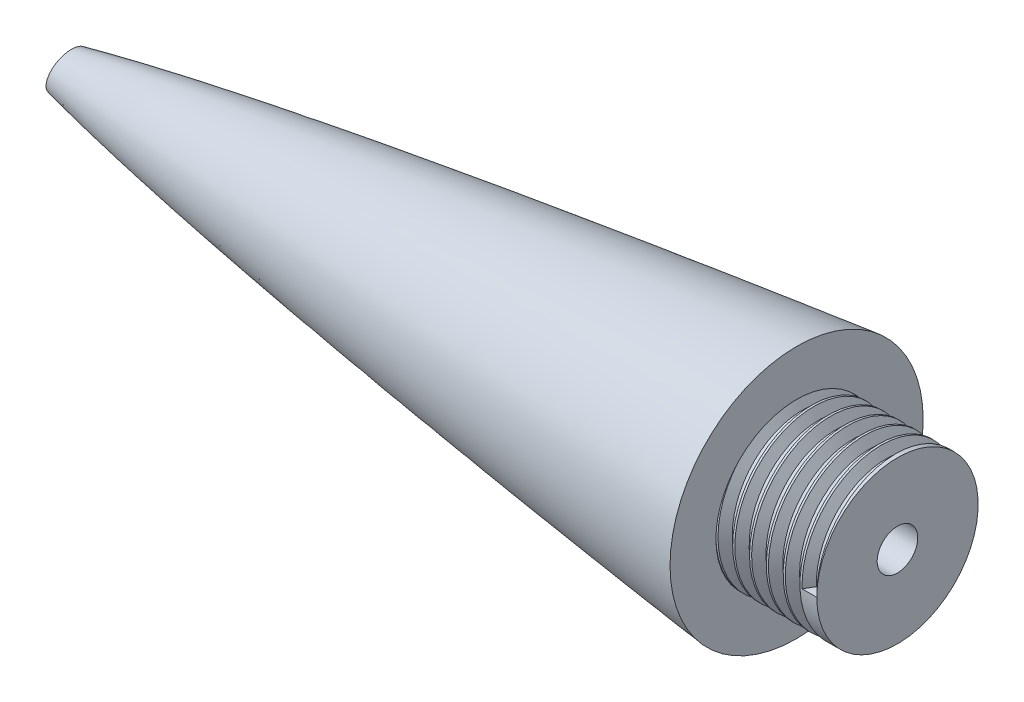
from build123d import *
from build123d.topology import SkipClean

# Parameters (mm, degrees)
F_1_4_20_TAPPED_HOLE1_D = 5.1054
THREAD1_PITCH           = 2.116666667


with BuildPart() as part:
    # Sketch1 → Revolve1 (revolve)
    with BuildSketch(Plane.XY, mode=Mode.PRIVATE) as revolve1_sk:
        with BuildLine():
            Line((0.05142254, -0.133795206), (113.188239409, -0.133795206))
            Line((113.188239409, -0.133795206), (113.188239409, 10.026204794))
            Line((113.188239409, 10.026204794), (100.488239409, 10.026204794))
            Line((100.488239409, 10.026204794), (100.488239409, 15.804704794))
            add(Edge.make_bspline(
                [(0.05142254, -0.133795206), (0.055161472, -0.126702709), (0.063846704, -0.113443896), (0.086385301, -0.090857927), (0.123997231, -0.061334579), (0.169647771, -0.029632405), (0.237333421, 0.012112406), (0.320573024, 0.058626249), (0.444018266, 0.121700565), (0.608983152, 0.198218673), (0.802340893, 0.280794479), (1.024099882, 0.368942406), (1.267356062, 0.460311872), (1.532095045, 0.554693469), (1.966901952, 0.702575649), (2.746199863, 0.949265752), (4.168961712, 1.358345956), (6.853306017, 2.043382986), (11.836626773, 3.157081906), (21.278657602, 4.98165519), (38.276629233, 7.791628586), (60.224819499, 10.894752718), (79.66144767, 13.351744234), (94.222006069, 15.079427213), (100.488239409, 15.804704794)],
                knots=[0, 0, 0, 0, 0, 3.9582e-05, 7.9164e-05, 0.000158327, 0.000237491, 0.000316655, 0.000474982, 0.00063331, 0.000927839, 0.001222369, 0.001522181, 0.001821993, 0.002222204, 0.002622415, 0.003809918, 0.005893539, 0.009595772, 0.016421024, 0.029243149, 0.053793085, 0.095411246, 0.126834738, 0.126834738, 0.126834738, 0.126834738, 0.126834738], degree=4))
        make_face()
    revolve(revolve1_sk.sketch.rotate(Axis((0.05142254, -0.133795206, 0), (1, 0, 0)), 180), axis=Axis((0.05142254, -0.133795206, 0), (1, 0, 0)))

    # 1/4-20 Tapped Hole1 (through all)
    with Locations(Plane(origin=(113.188239409, 0, 0), x_dir=(0, 0, -1), z_dir=(1, 0, 0))):
        with Locations((0, 0)):
            Hole(F_1_4_20_TAPPED_HOLE1_D / 2)

    # Thread1: the profile of Thread Profile1 profile screwed along a right-hand helix of 6 turns, 10 arcs to a turn; built about Z, then put on its axis
    with SkipClean():  # the faces are left unmerged after this step: merging them gives an invalid solid
        thread1_z = Axis((0, 0, 0), (0, 0, 1))
        thread1_corners = [(10.1603, 0, -0.000173205), (10.1603, 0, 1.852256533), (9.014320565, 0, 1.190624997), (9.014320565, 0, 0.66145833)]
        with BuildLine(mode=Mode.PRIVATE) as thread1_profile:
            Line(thread1_corners[0], thread1_corners[1])
            Line(thread1_corners[1], thread1_corners[2])
            Line(thread1_corners[2], thread1_corners[3])
            Line(thread1_corners[3], thread1_corners[0])
        thread1_cap = Face(thread1_profile.wire())
        thread1_turn_angles = [0, 18, 36, 54, 72, 90, 108, 126, 144, 162, 180, 198, 216, 234, 252, 270, 288, 306, 324, 342, 360]
        thread1_turn_weights = [1, 0.9510565162951535, 1, 0.9510565162951535, 1, 0.9510565162951535, 1, 0.9510565162951535, 1, 0.9510565162951535, 1, 0.9510565162951535, 1, 0.9510565162951535, 1, 0.9510565162951535, 1, 0.9510565162951535, 1, 0.9510565162951535, 1]
        thread1_turn_rails = [Edge.make_bspline([Vector(p[0], p[1], 0).rotate(thread1_z, thread1_turn_angles[k]) / thread1_turn_weights[k] + Vector(0, 0, p[2] + THREAD1_PITCH * thread1_turn_angles[k] / 360) for k in range(21)], [0, 0, 0, 1, 1, 2, 2, 3, 3, 4, 4, 5, 5, 6, 6, 7, 7, 8, 8, 9, 9, 10, 10, 10], 2, thread1_turn_weights) for p in thread1_corners]
        thread1_turn_sides = [Face.make_surface_from_curves(thread1_turn_rails[p[0]], thread1_turn_rails[p[1]]) for p in [(0, 1), (1, 2), (2, 3), (3, 0)]]
        thread1 = Plane(origin=(113.188239409, -0.133795206, 0), x_dir=(0, 0, 1), z_dir=(-1, 0, 0)) * Solid(Shell([*[p.moved(Location((0, 0, THREAD1_PITCH * i))) for i in range(6) for p in thread1_turn_sides], thread1_cap, thread1_cap.rotate(thread1_z, 2160).moved(Location((0, 0, THREAD1_PITCH * 2160 / 360)))]))
        add(thread1, mode=Mode.SUBTRACT)


solid = part.part
